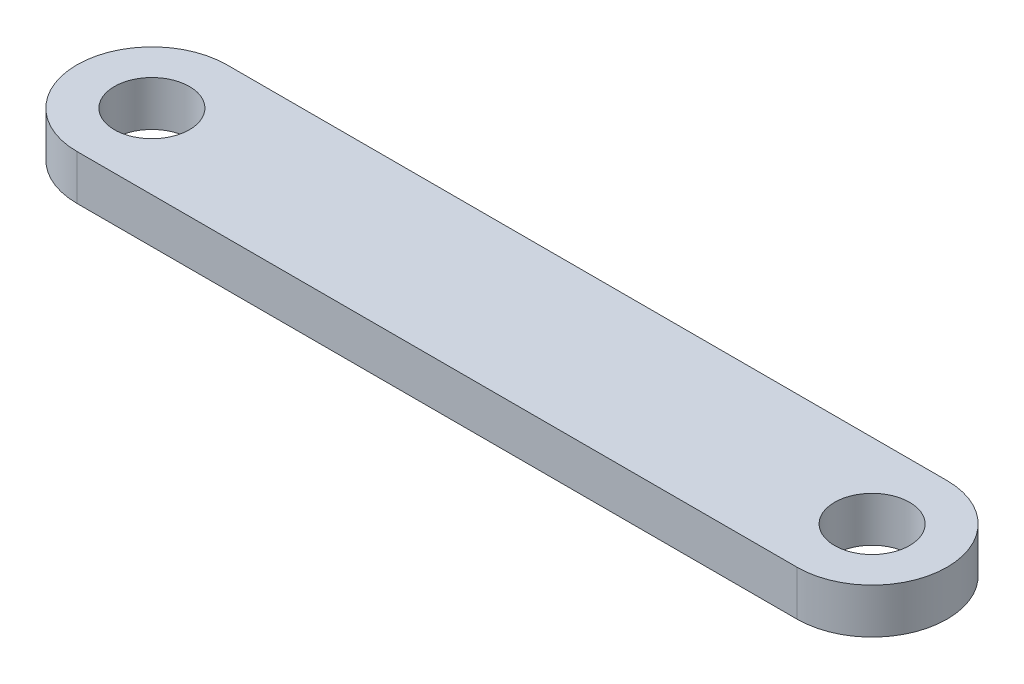
from build123d import *

# Parameters (mm, degrees)
SKETCH1_R           = 3.175
BOSS_EXTRUDE1_DEPTH = 3.81


with BuildPart() as part:
    # Sketch1 → Boss-Extrude1 (new body)
    with BuildSketch(Plane(origin=(0, 0, 0), x_dir=(1, 0, 0), z_dir=(0, 1, 0))):
        with BuildLine():
            Line((-30.48, 6.35), (30.48, 6.35))
            ThreePointArc((30.48, 6.35), (36.83, 0), (30.48, -6.35))
            Line((30.48, -6.35), (-30.48, -6.35))
            ThreePointArc((-30.48, -6.35), (-36.83, 0), (-30.48, 6.35))
        make_face()
        with Locations((-30.48, 0)):
            Circle(SKETCH1_R, mode=Mode.SUBTRACT)
        with Locations((30.48, 0)):
            Circle(SKETCH1_R, mode=Mode.SUBTRACT)
    extrude(amount=BOSS_EXTRUDE1_DEPTH)


solid = part.part
